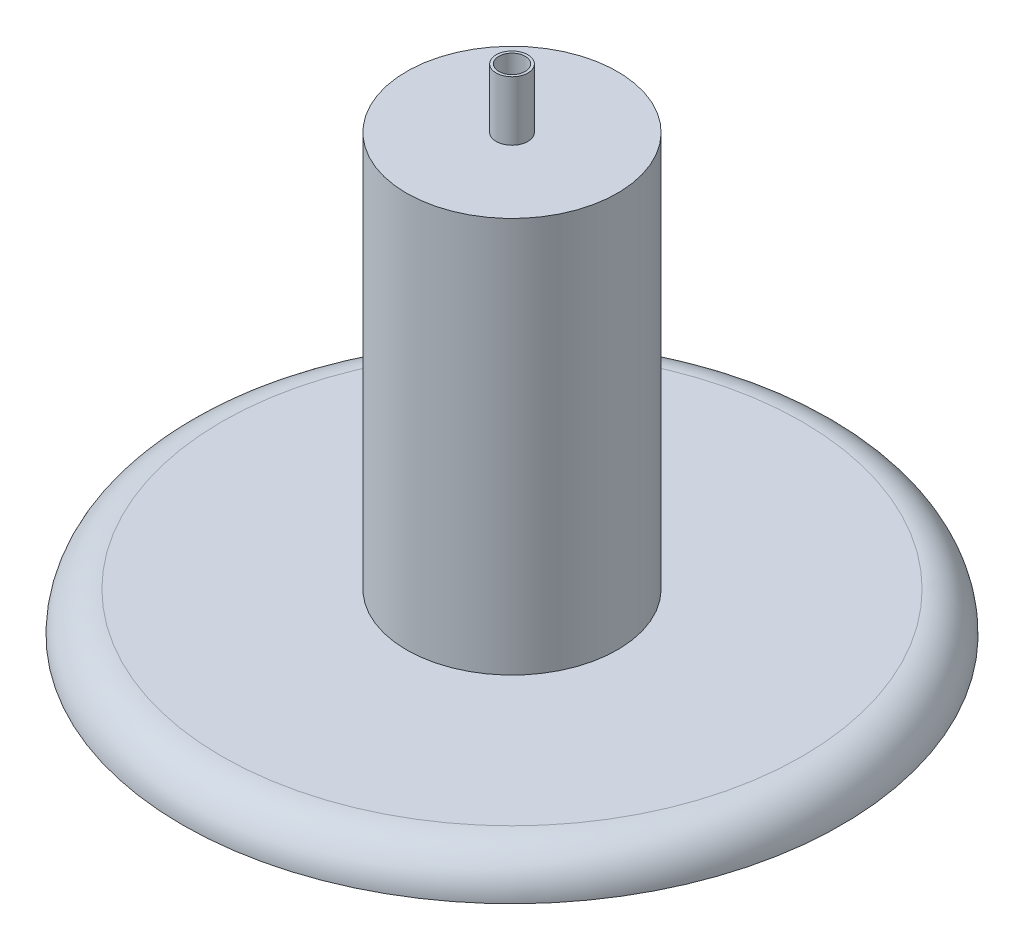
from build123d import *

# Parameters (mm, degrees)
SKETCH_1_R          = 250
EXTRUDE_2_DEPTH     = 30
FILLET_1_R          = 30
SKETCH_4_R          = 80
EXTRUDE_4_DEPTH     = 300
SKETCH_5_R          = 12
EXTRUDE_6_DEPTH     = 45
SKETCH_6_R          = 10
CUT_EXTRUDE_2_DEPTH = 45


with BuildPart() as part:
    # 草图1 → 凸台-拉伸2 (new body)
    with BuildSketch(Plane(origin=(0, 0, 0), x_dir=(1, 0, 0), z_dir=(0, 1, 0))):
        with Locations(Location((0, 0, 0), (0, 0, 270))):
            Circle(SKETCH_1_R)
    extrude(amount=EXTRUDE_2_DEPTH)

    # 圆角1
    fillet_1_edges = [part.edges().sort_by_distance(p)[0] for p in [
        (0, 30, -250),
    ]]
    fillet(fillet_1_edges, radius=FILLET_1_R - 0.0001)  # a hair under: the kernel refuses the full size

    # 草图4 → 凸台-拉伸4 (add)
    with BuildSketch(Plane(origin=(0, 30, 0), x_dir=(1, 0, 0), z_dir=(0, 1, 0))):
        with Locations(Location((0, 0, 0), (0, 0, 270))):
            Circle(SKETCH_4_R)
    extrude(amount=EXTRUDE_4_DEPTH)

    # 草图5 → 凸台-拉伸6 (add)
    with BuildSketch(Plane(origin=(0, 330, 0), x_dir=(1, 0, 0), z_dir=(0, 1, 0))):
        with Locations(Location((0, 0, 0), (0, 0, 90))):
            Circle(SKETCH_5_R)
    extrude(amount=EXTRUDE_6_DEPTH)

    # 草图6 → 切除-拉伸2 (cut)
    with BuildSketch(Plane(origin=(0, 375, 0), x_dir=(1, 0, 0), z_dir=(0, 1, 0))):
        with Locations(Location((0, 0, 0), (0, 0, 270))):
            Circle(SKETCH_6_R)
    extrude(amount=-CUT_EXTRUDE_2_DEPTH, mode=Mode.SUBTRACT)


solid = part.part
